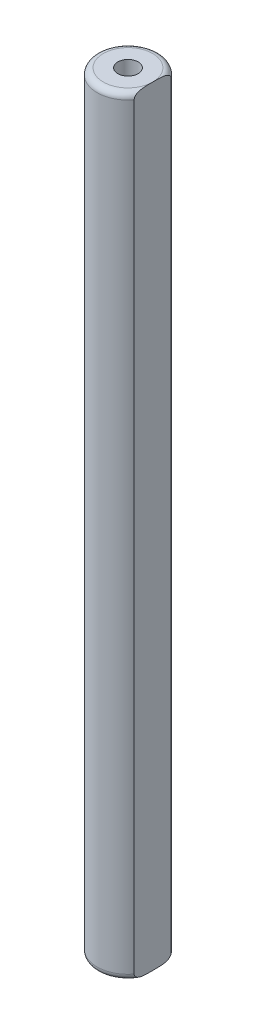
from build123d import *

# Parameters (mm, degrees)
SKETCH1_R            = 2.5
BOSS_EXTRUDE1_DEPTH  = 31.15
SKETCH2_R            = 0.825
CUT_EXTRUDE1_DEPTH   = 5
CUT_EXTRUDE2_DEPTH   = 32.35
FILLET1_R            = 0.5
FILLET1_OF_MIRROR1_R = 0.5


with BuildPart() as part:
    # Sketch1 → Boss-Extrude1 (new body)
    with BuildSketch(Plane(origin=(0, 0, 0), x_dir=(1, 0, 0), z_dir=(0, 1, 0))):
        with Locations(Location((0, 0, 0), (0, 0, 270))):
            Circle(SKETCH1_R)
    boss_extrude1 = extrude(amount=BOSS_EXTRUDE1_DEPTH)

    # Sketch2 → Cut-Extrude1 (cut)
    with BuildSketch(Plane(origin=(0, 31.15, 0), x_dir=(1, 0, 0), z_dir=(0, 1, 0))):
        with Locations(Location((0, 0, 0), (0, 0, 270))):
            Circle(SKETCH2_R)
    cut_extrude1 = extrude(amount=-CUT_EXTRUDE1_DEPTH, mode=Mode.SUBTRACT)

    # Sketch3 → Cut-Extrude2 (cut, through all)
    with BuildSketch(Plane(origin=(0, 31.15, 0), x_dir=(1, 0, 0), z_dir=(0, 1, 0))):
        with BuildLine():
            Line((2, 1.5), (2, -1.5))
            ThreePointArc((2, -1.5), (2.5, 0), (2, 1.5))
        make_face()
    cut_extrude2 = extrude(amount=-CUT_EXTRUDE2_DEPTH, mode=Mode.SUBTRACT)

    # Fillet1
    fillet1_edges = [part.edges().sort_by_distance(p)[0] for p in [
        (-2.5, 31.15, 0),
    ]]
    fillet(fillet1_edges, radius=FILLET1_R - 0.0001)  # a hair under: the kernel refuses the full size

    # Mirror1: Boss-Extrude1, Cut-Extrude1, Cut-Extrude2 across plane
    add(boss_extrude1.mirror(Plane.ZX))
    add(cut_extrude1.mirror(Plane.ZX), mode=Mode.SUBTRACT)
    add(cut_extrude2.mirror(Plane.ZX), mode=Mode.SUBTRACT)

    # Fillet1 of Mirror1
    fillet1_of_mirror1_edges = [part.edges().sort_by_distance(p)[0] for p in [
        (-2.5, -31.15, 0),
    ]]
    fillet(fillet1_of_mirror1_edges, radius=FILLET1_OF_MIRROR1_R - 0.0001)  # a hair under: the kernel refuses the full size


solid = part.part
